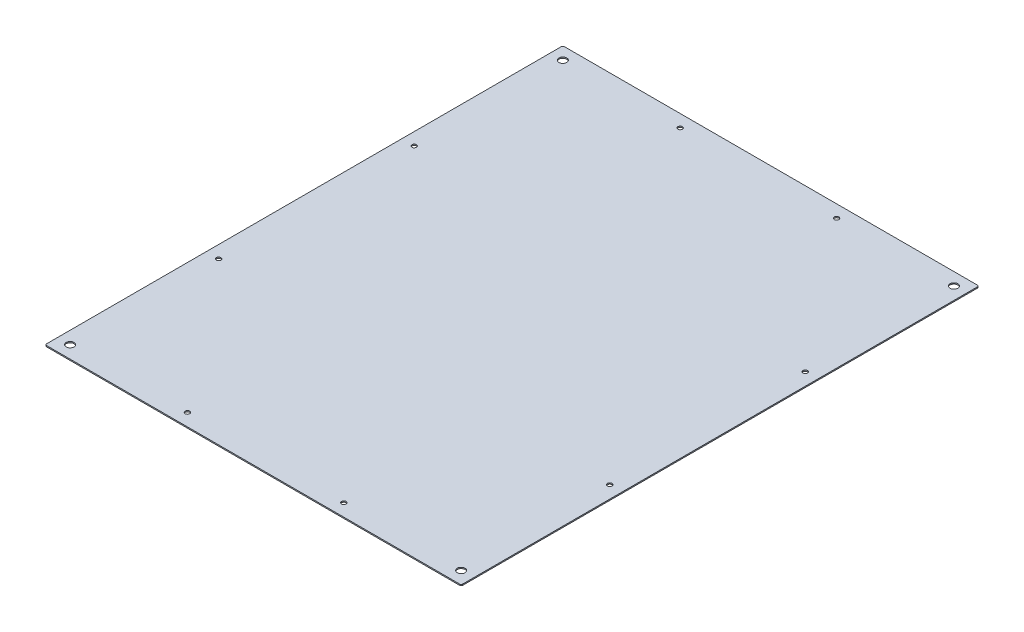
from build123d import *

# Parameters (mm, degrees)
SKETCH1_W            = 662
SKETCH1_H            = 532
BASE_FLANGE1_DEPTH   = 1.5
FILLET1_R            = 2
M8_CLEARANCE_HOLE1_D = 10
M5_CLEARANCE_HOLE1_D = 5.8


# Sheet-metal steps are written as plain solids
with BuildPart() as part:
    # Sketch1 → Base-Flange1 (new body)
    with BuildSketch(Plane(origin=(0, 0, 0), x_dir=(0, 0, -1), z_dir=(0, 1, 0))):
        Rectangle(SKETCH1_W, SKETCH1_H)
    extrude(amount=-BASE_FLANGE1_DEPTH)

    # Fillet1
    fillet1_edges = [part.edges().sort_by_distance(p)[0] for p in [
        (-266, -0.75, 331),
        (-266, -0.75, -331),
        (266, -0.75, -331),
        (266, -0.75, 331),
    ]]
    fillet(fillet1_edges, radius=FILLET1_R)

    # M8 Clearance Hole1 (through all)
    with Locations(Plane(origin=(0, 0, 0), x_dir=(1, 0, 0), z_dir=(0, 1, 0))):
        with Locations((-250, -315), (250, -315), (250, 315), (-250, 315)):
            Hole(M8_CLEARANCE_HOLE1_D / 2)

    # M5 Clearance Hole1 (through all)
    with Locations(Plane(origin=(0, 0, 0), x_dir=(1, 0, 0), z_dir=(0, 1, 0))):
        with Locations((100, 315), (-100, 315), (-250, 125), (-250, -125), (-100, -315), (100, -315), (250, -125), (250, 125)):
            Hole(M5_CLEARANCE_HOLE1_D / 2)


solid = part.part
